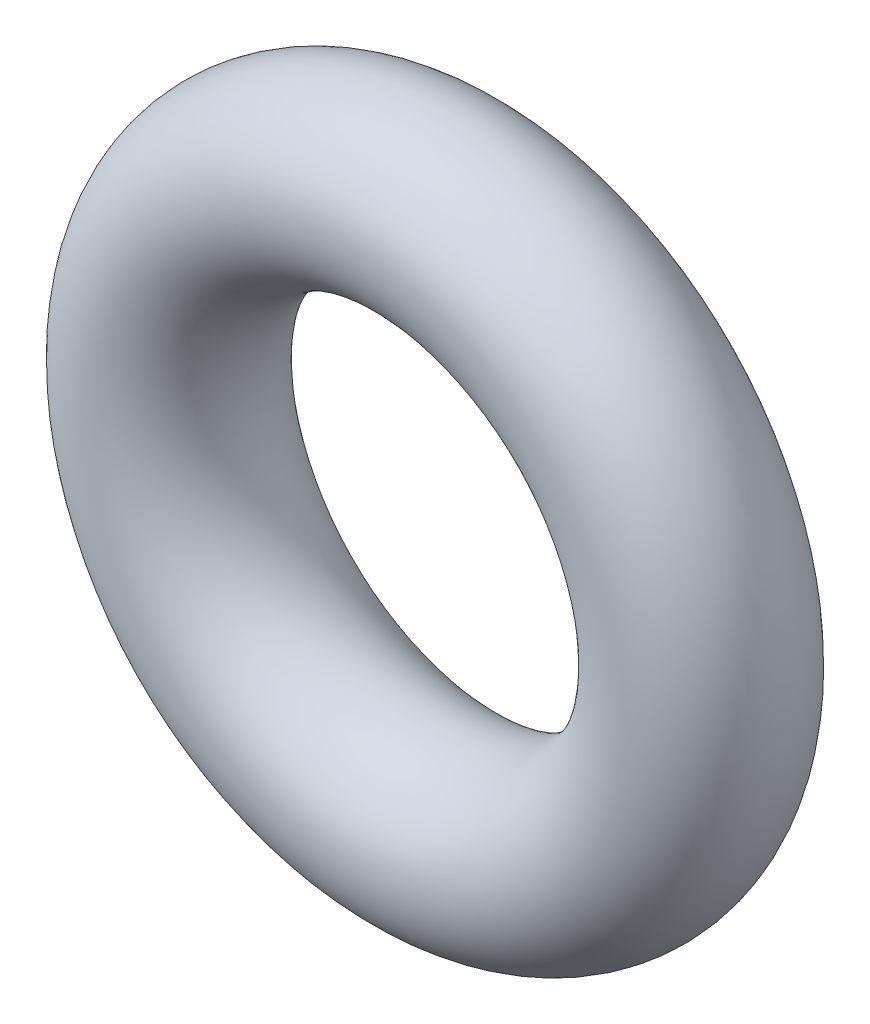
from build123d import *

# Parameters (mm, degrees)
SKETCH1_R = 0.889


with BuildPart() as part:
    # Sketch1 → Revolve1 (revolve)
    with BuildSketch(Plane(origin=(0, 0, 0), x_dir=(0, -1, 0), z_dir=(1, 0, 0))):
        with Locations((2.7305, 0)):
            Circle(SKETCH1_R)
    revolve(axis=Axis((0, 0, 0.889), (0, 0, -1)))


solid = part.part
